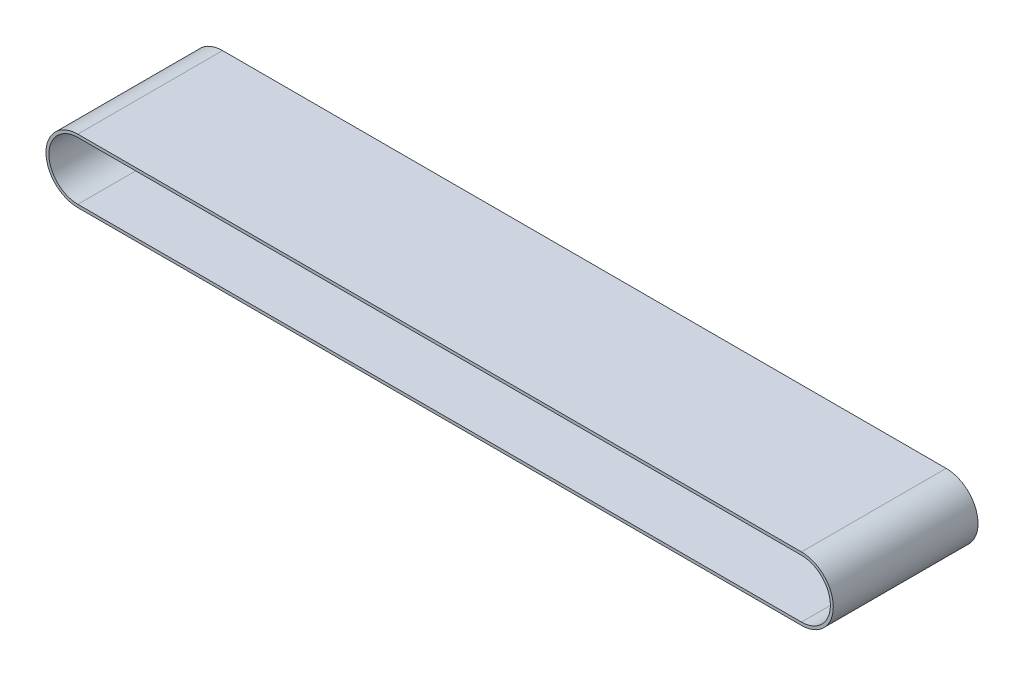
from build123d import *

# Parameters (mm, degrees)
BOSS_EXTRUDE1_DEPTH = 100
SHELL2_T            = -2


with BuildPart() as part:
    # Sketch1 → Boss-Extrude1 (new body)
    with BuildSketch(Plane.XY):
        with BuildLine():
            Line((-421.346770179, 20), (78.653229821, 20))
            ThreePointArc((78.653229821, 20), (100.653229821, -2), (78.653229821, -24))
            Line((78.653229821, -24), (-421.346770179, -24))
            ThreePointArc((-421.346770179, -24), (-443.346770179, -2), (-421.346770179, 20))
        make_face()
    extrude(amount=BOSS_EXTRUDE1_DEPTH)

    # Shell2
    shell2_openings = [part.faces().sort_by_distance(p)[0] for p in [
        (-171.346770179, -2, 0),
        (-171.346770179, -2, 100),
    ]]
    offset(amount=SHELL2_T, openings=shell2_openings, kind=Kind.INTERSECTION)


solid = part.part
